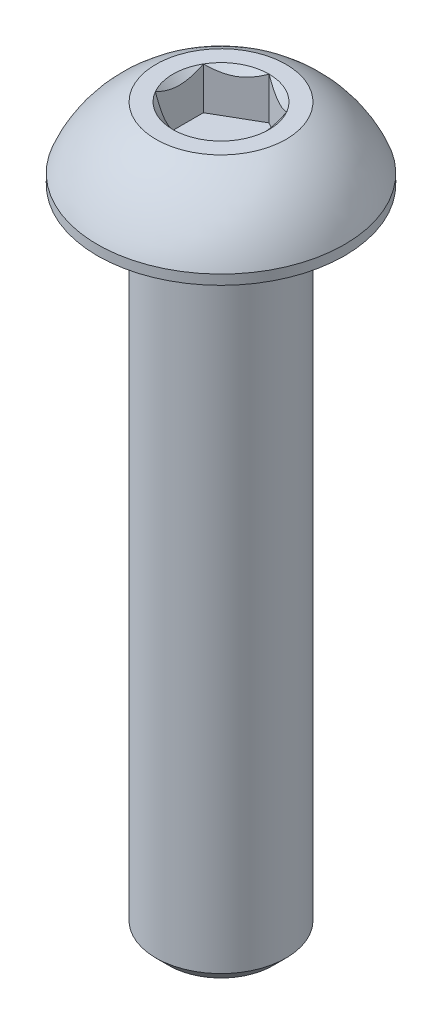
from build123d import *

# Parameters (mm, degrees)
SKETCH1_R           = 2
BOSS_EXTRUDE1_DEPTH = 20
CHAMFER1_SIZE       = 0.4
SKETCH2_R           = 3.8
BOSS_EXTRUDE2_DEPTH = 2.2
CUT_EXTRUDE1_DEPTH  = 1.3
SKETCH5_R           = 1.478016689
CUT_EXTRUDE2_DEPTH  = 1
CUT_EXTRUDE2_DRAFT  = -45


with BuildPart() as part:
    # Sketch1 → Boss-Extrude1 (new body)
    with BuildSketch(Plane(origin=(0, 0, 0), x_dir=(1, 0, 0), z_dir=(0, 1, 0))):
        Circle(SKETCH1_R)
    extrude(amount=-BOSS_EXTRUDE1_DEPTH)

    # Chamfer1
    chamfer1_edges = [part.edges().sort_by_distance(p)[0] for p in [
        (-2, -20, 0),
    ]]
    chamfer(chamfer1_edges, length=CHAMFER1_SIZE)

    # Sketch2 → Boss-Extrude2 (add)
    with BuildSketch(Plane(origin=(0, 0, 0), x_dir=(1, 0, 0), z_dir=(0, 1, 0))):
        Circle(SKETCH2_R)
    extrude(amount=BOSS_EXTRUDE2_DEPTH)

    # Sketch3 → Cut-Revolve1 (revolve, cut)
    with BuildSketch(Plane.XY):
        with BuildLine():
            Line((-2, 2.2), (-2, 2.7))
            Line((-2, 2.7), (-4.3, 2.7))
            Line((-4.3, 2.7), (-4.3, 0.3))
            Line((-4.3, 0.3), (-3.8, 0.3))
            ThreePointArc((-3.8, 0.3), (-3.084281951, 1.424582901), (-2, 2.2))
        make_face()
    revolve(axis=Axis((0, 0, 0), (0, 1, 0)), mode=Mode.SUBTRACT)

    # Sketch4 → Cut-Extrude1 (cut)
    with BuildSketch(Plane(origin=(0, 2.2, 0), x_dir=(1, 0, 0), z_dir=(0, 1, 0))):
        Polygon((0, 1.478016689), (-1.28, 0.739008345), (-1.28, -0.739008345), (0, -1.478016689), (1.28, -0.739008345), (1.28, 0.739008345), align=None)
    extrude(amount=-CUT_EXTRUDE1_DEPTH, mode=Mode.SUBTRACT)


with BuildPart() as cut_extrude2_tool:
    # Sketch5 → Cut-Extrude2 (with draft: the straight prism first)
    with BuildSketch(Plane(origin=(0, 2.2, 0), x_dir=(1, 0, 0), z_dir=(0, 1, 0))):
        Circle(SKETCH5_R)
    extrude(amount=-CUT_EXTRUDE2_DEPTH)
    # Cut-Extrude2: the draft: its side faces are tilted about the plane it starts from
    cut_extrude2_sides = [cut_extrude2_tool.faces().sort_by_distance(p)[0] for p in [
        (-1.478016689, 1.7, 0),
    ]]
    draft(cut_extrude2_sides, Plane(origin=(0, 2.2, 0), x_dir=(1, 0, 0), z_dir=(0, 1, 0)), CUT_EXTRUDE2_DRAFT)


with BuildPart() as part_1:
    add(part.part)

    # Cut-Extrude2: cut by cut_extrude2_tool
    add(cut_extrude2_tool.part, mode=Mode.SUBTRACT)


solid = part_1.part
